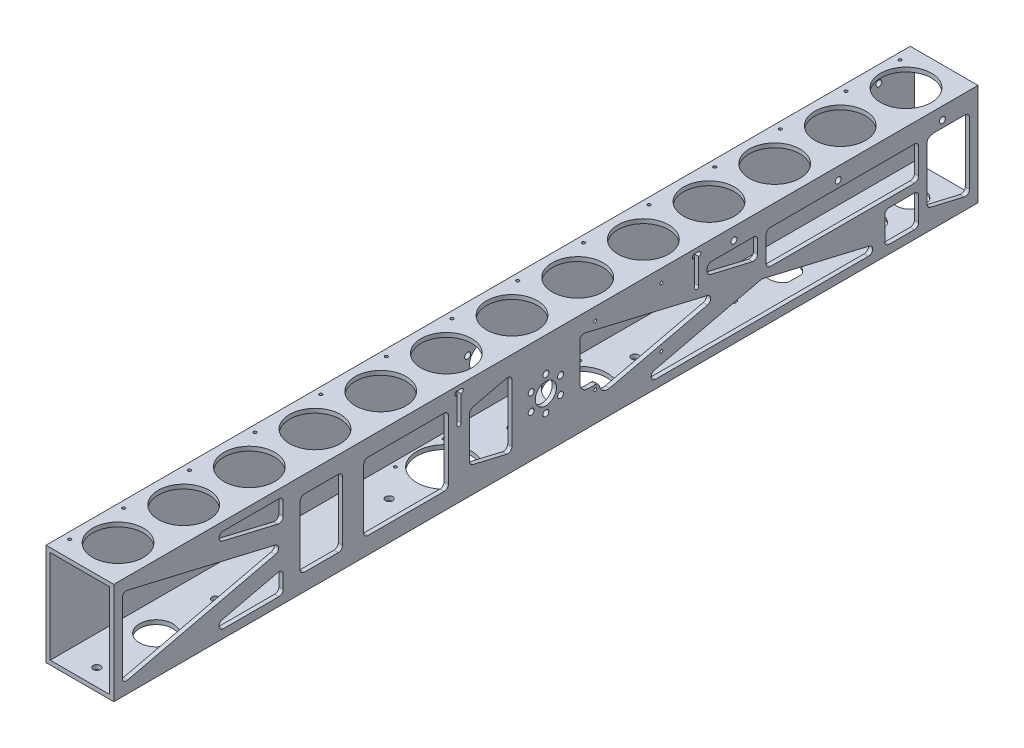
from build123d import *

# Parameters (mm, degrees)
SKETCH1_W                   = 50.8
SKETCH1_H                   = 76.2
SKETCH1_W_2                 = 44.45
SKETCH1_H_2                 = 69.85
BOSS_EXTRUDE1_DEPTH         = 647.7
CUT_EXTRUDE1_DEPTH          = 655.142469192
SKETCH4_R                   = 7.9375
CUT_EXTRUDE3_DEPTH          = 655.142469192
CUT_EXTRUDE4_REACH          = 656.142
SKETCH5_R                   = 9.525
F_8_CLEARANCE_HOLE1_D       = 4.4958
CIRPATTERN1_COUNT           = 6
SKETCH10_W                  = 57.15
SKETCH10_H                  = 76.2
BOSS_EXTRUDE2_DEPTH         = 3.175
CUT_EXTRUDE6_REACH          = 656.142
SKETCH17_W                  = 31.75
SKETCH17_H                  = 50.8
CUT_EXTRUDE10_REACH         = 656.142
SKETCH21_R                  = 20.447
F_4_40_TAPPED_HOLE1_D       = 2.2606
F_4_40_TAPPED_HOLE1_DEPTH   = 3.175
CUT_EXTRUDE11_REACH         = 656.142
LPATTERN1_COUNT             = 4
LPATTERN1_PITCH             = 31.75
SKETCH25_OUTSIDE_W          = 183.628
SKETCH25_OUTSIDE_H          = 780.528
SKETCH25_OUTSIDE_W_2        = 50.8
SKETCH25_OUTSIDE_H_2        = 647.7
CUT_EXTRUDE12_DEPTH         = 1.5875
F_1_4_28_TAPPED_HOLE2_D     = 5.4102
F_1_4_28_TAPPED_HOLE2_DEPTH = 3.175
CUT_EXTRUDE13_REACH         = 656.142
SKETCH28_R                  = 19.05
CUT_EXTRUDE14_REACH         = 656.142
SKETCH29_R                  = 19.05
BOSS_EXTRUDE3_DEPTH         = 3.175
BOSS_EXTRUDE4_DEPTH         = 3.175
BOSS_EXTRUDE5_DEPTH         = 3.175
BOSS_EXTRUDE6_START         = -3.175
BOSS_EXTRUDE6_DEPTH         = 3.175
CUT_EXTRUDE15_REACH         = 656.142
FILLET1_R                   = 3.175
BOSS_EXTRUDE7_DEPTH         = 3.175
FILLET2_R                   = 6.35
F_4_40_TAPPED_HOLE2_D       = 2.2606
F_4_40_TAPPED_HOLE2_DEPTH   = 3.175
SKETCH40_R                  = 19.05
SKETCH40_R_2                = 12.446
BOSS_EXTRUDE8_DEPTH         = 3.175
SKETCH41_W                  = 202.946
SKETCH41_H                  = 14.2875
BOSS_EXTRUDE9_DEPTH         = 3.175
FILLET3_R                   = 3.175
F_8_CLEARANCE_HOLE2_D       = 4.4958
F_8_CLEARANCE_HOLE2_DEPTH   = 3.175
SKETCH44_W                  = 202.946
SKETCH44_H                  = 14.2875
BOSS_EXTRUDE10_DEPTH        = 3.175
FILLET4_R                   = 3.175
F_8_CLEARANCE_HOLE3_D       = 4.4958
BOSS_EXTRUDE11_DEPTH        = 3.175
FILLET5_R                   = 3.175
CUT_EXTRUDE16_REACH         = 656.142
CUT_EXTRUDE17_REACH         = 656.142
SKETCH51_W                  = 68.2625
SKETCH51_H                  = 63.5
BOSS_EXTRUDE12_DEPTH        = 3.175
CUT_EXTRUDE18_REACH         = 656.142
BOSS_EXTRUDE13_DEPTH        = 1.016
F_4_40_TAPPED_HOLE3_D       = 2.2606
F_4_40_TAPPED_HOLE3_DEPTH   = 7.62
F_4_40_TAPPED_HOLE3_TIP     = 0.679152758
F_4_40_TAPPED_HOLE4_D       = 2.2606
F_4_40_TAPPED_HOLE4_DEPTH   = 7.62
F_4_40_TAPPED_HOLE4_TIP     = 0.679152758
BOSS_EXTRUDE14_DEPTH        = 3.175
BOSS_EXTRUDE15_START        = -1.016
BOSS_EXTRUDE15_DEPTH        = 1.016
FILLET6_R                   = 3.175
CUT_EXTRUDE19_START         = -2.159
CUT_EXTRUDE19_DEPTH         = 2.159


with BuildPart() as part:
    # Sketch1 → Boss-Extrude1 (new body)
    with BuildSketch(Plane.XY):
        with Locations((25.4, 38.1)):
            Rectangle(SKETCH1_W, SKETCH1_H)
        with Locations((25.4, 38.1)):
            Rectangle(SKETCH1_W_2, SKETCH1_H_2, mode=Mode.SUBTRACT)
    extrude(amount=BOSS_EXTRUDE1_DEPTH)

    # Sketch2 → Cut-Extrude1 (cut, through all)
    with BuildSketch(Plane(origin=(50.8, 0, 0), x_dir=(0, 0, -1), z_dir=(1, 0, 0))):
        with BuildLine():
            ThreePointArc((-566.359206485, 63.584400491), (-568.785835896, 67.041040679), (-565.632006601, 69.85))
            Line((-565.632006601, 69.85), (-405.917993399, 69.85))
            ThreePointArc((-405.917993399, 69.85), (-402.764164104, 67.041040679), (-405.190793515, 63.584400491))
            Line((-405.190793515, 63.584400491), (-485.047800115, 44.794516585))
            ThreePointArc((-485.047800115, 44.794516585), (-485.775, 44.710116094), (-486.502199885, 44.794516585))
            Line((-486.502199885, 44.794516585), (-566.359206485, 63.584400491))
        make_face()
        with BuildLine():
            Line((-637.447800115, 8.935693055), (-526.634543515, 35.009400491))
            ThreePointArc((-526.634543515, 35.009400491), (-524.186743399, 38.1), (-526.634543515, 41.190599509))
            Line((-526.634543515, 41.190599509), (-637.447800115, 67.264306945))
            ThreePointArc((-637.447800115, 67.264306945), (-640.146264235, 66.662631363), (-641.35, 64.173707435))
            Line((-641.35, 64.173707435), (-641.35, 12.026292565))
            ThreePointArc((-641.35, 12.026292565), (-640.146264235, 9.537368637), (-637.447800115, 8.935693055))
        make_face()
        with BuildLine():
            Line((-485.047800115, 31.405483415), (-405.190793515, 12.615599509))
            ThreePointArc((-405.190793515, 12.615599509), (-402.764164104, 9.158959321), (-405.917993399, 6.35))
            Line((-405.917993399, 6.35), (-565.632006601, 6.35))
            ThreePointArc((-565.632006601, 6.35), (-568.785835896, 9.158959321), (-566.359206485, 12.615599509))
            Line((-566.359206485, 12.615599509), (-486.502199885, 31.405483415))
            ThreePointArc((-486.502199885, 31.405483415), (-485.775, 31.489883906), (-485.047800115, 31.405483415))
        make_face()
        with BuildLine():
            ThreePointArc((-444.915456485, 35.009400491), (-447.363256601, 38.1), (-444.915456485, 41.190599509))
            Line((-444.915456485, 41.190599509), (-353.152199885, 62.781954004))
            ThreePointArc((-353.152199885, 62.781954004), (-350.453735765, 62.180278422), (-349.25, 59.691354494))
            Line((-349.25, 59.691354494), (-349.25, 16.508645506))
            ThreePointArc((-349.25, 16.508645506), (-350.453735765, 14.019721578), (-353.152199885, 13.418045996))
            Line((-353.152199885, 13.418045996), (-444.915456485, 35.009400491))
        make_face()
        with BuildLine():
            Line((-294.547800115, 62.781954004), (-202.784543515, 41.190599509))
            ThreePointArc((-202.784543515, 41.190599509), (-200.336743399, 38.1), (-202.784543515, 35.009400491))
            Line((-202.784543515, 35.009400491), (-294.547800115, 13.418045996))
            ThreePointArc((-294.547800115, 13.418045996), (-297.246264235, 14.019721578), (-298.45, 16.508645506))
            Line((-298.45, 16.508645506), (-298.45, 59.691354494))
            ThreePointArc((-298.45, 59.691354494), (-297.246264235, 62.180278422), (-294.547800115, 62.781954004))
        make_face()
        with BuildLine():
            ThreePointArc((-161.197800115, 44.794516585), (-161.925, 44.710116094), (-162.652199885, 44.794516585))
            Line((-162.652199885, 44.794516585), (-242.509206485, 63.584400491))
            ThreePointArc((-242.509206485, 63.584400491), (-244.935835896, 67.041040679), (-241.782006601, 69.85))
            Line((-241.782006601, 69.85), (-82.067993399, 69.85))
            ThreePointArc((-82.067993399, 69.85), (-78.914164104, 67.041040679), (-81.340793515, 63.584400491))
            Line((-81.340793515, 63.584400491), (-161.197800115, 44.794516585))
        make_face()
        with BuildLine():
            Line((-161.197800115, 31.405483415), (-81.340793515, 12.615599509))
            ThreePointArc((-81.340793515, 12.615599509), (-78.914164104, 9.158959321), (-82.067993399, 6.35))
            Line((-82.067993399, 6.35), (-241.782006601, 6.35))
            ThreePointArc((-241.782006601, 6.35), (-244.935835896, 9.158959321), (-242.509206485, 12.615599509))
            Line((-242.509206485, 12.615599509), (-162.652199885, 31.405483415))
            ThreePointArc((-162.652199885, 31.405483415), (-161.925, 31.489883906), (-161.197800115, 31.405483415))
        make_face()
        with BuildLine():
            Line((-121.065456485, 41.190599509), (-10.252199885, 67.264306945))
            ThreePointArc((-10.252199885, 67.264306945), (-7.553735765, 66.662631363), (-6.35, 64.173707435))
            Line((-6.35, 64.173707435), (-6.35, 12.026292565))
            ThreePointArc((-6.35, 12.026292565), (-7.553735765, 9.537368637), (-10.252199885, 8.935693055))
            Line((-10.252199885, 8.935693055), (-121.065456485, 35.009400491))
            ThreePointArc((-121.065456485, 35.009400491), (-123.513256601, 38.1), (-121.065456485, 41.190599509))
        make_face()
    extrude(amount=-CUT_EXTRUDE1_DEPTH, mode=Mode.SUBTRACT)

    # Sketch4 → Cut-Extrude3 (cut, through all)
    with BuildSketch(Plane(origin=(50.8, 0, 0), x_dir=(0, 0, -1), z_dir=(1, 0, 0))):
        with Locations((-323.85, 38.1)):
            Circle(SKETCH4_R)
    extrude(amount=-CUT_EXTRUDE3_DEPTH, mode=Mode.SUBTRACT)

    # Sketch5 → Cut-Extrude4 (cut, up to next)
    with BuildSketch(Plane.ZY, mode=Mode.PRIVATE) as cut_extrude4_sk1:
        with Locations((323.85, 38.1)):
            Circle(SKETCH5_R)
    cut_extrude4_tool1 = extrude(cut_extrude4_sk1.sketch, amount=-CUT_EXTRUDE4_REACH, mode=Mode.PRIVATE) & part.part
    add(cut_extrude4_tool1.solids().sort_by_distance((0, 38.1, 323.85))[0], mode=Mode.SUBTRACT)

    # #8 Clearance Hole1 (through all)
    with Locations(Plane.ZY):
        with Locations((323.85, 50.8)):
            f_8_clearance_hole1 = Hole(F_8_CLEARANCE_HOLE1_D / 2)

    # CirPattern1: #8 Clearance Hole1 ×6 about axis
    cirpattern1_axis = Axis((0, 38.1, 323.85), (1, 0, 0))
    for i in range(1, CIRPATTERN1_COUNT):
        add(f_8_clearance_hole1.rotate(cirpattern1_axis, i * 360 / CIRPATTERN1_COUNT), mode=Mode.SUBTRACT)

    # Sketch10 → Boss-Extrude2 (add)
    with BuildSketch(Plane(origin=(50.8, 0, 0), x_dir=(0, 0, -1), z_dir=(1, 0, 0))):
        with Locations((-492.125, 38.1)):
            Rectangle(SKETCH10_W, SKETCH10_H)
    extrude(amount=-BOSS_EXTRUDE2_DEPTH)

    # Sketch17 → Cut-Extrude6 (cut, up to next)
    with BuildSketch(Plane(origin=(50.8, 0, 0), x_dir=(0, 0, -1), z_dir=(1, 0, 0)), mode=Mode.PRIVATE) as cut_extrude6_sk1:
        with Locations((-492.125, 38.1)):
            Rectangle(SKETCH17_W, SKETCH17_H)
    cut_extrude6_tool1 = extrude(cut_extrude6_sk1.sketch, amount=-CUT_EXTRUDE6_REACH, mode=Mode.PRIVATE) & part.part
    add(cut_extrude6_tool1.solids().sort_by_distance((50.8, 38.1, 492.125))[0], mode=Mode.SUBTRACT)

    # Sketch21 → Cut-Extrude10 (cut, up to next)
    with BuildSketch(Plane.XZ, mode=Mode.PRIVATE) as cut_extrude10_sk1:
        with Locations(Location((25.4, 374.65, 0), (0, 0, 270))):
            Circle(SKETCH21_R)
    cut_extrude10_tool1 = extrude(cut_extrude10_sk1.sketch, amount=-CUT_EXTRUDE10_REACH, mode=Mode.PRIVATE) & part.part
    # Sketch21 → Cut-Extrude10 (cut, up to next)
    with BuildSketch(Plane.XZ, mode=Mode.PRIVATE) as cut_extrude10_sk2:
        with Locations(Location((25.4, 273.05, 0), (0, 0, 270))):
            Circle(SKETCH21_R)
    cut_extrude10_tool2 = extrude(cut_extrude10_sk2.sketch, amount=-CUT_EXTRUDE10_REACH, mode=Mode.PRIVATE) & part.part
    add(cut_extrude10_tool1.solids().sort_by_distance((25.4, 0, 374.65))[0], mode=Mode.SUBTRACT)
    add(cut_extrude10_tool2.solids().sort_by_distance((25.4, 0, 273.05))[0], mode=Mode.SUBTRACT)

    # #4-40 Tapped Hole1
    with Locations(Plane.XZ):
        with Locations((7.1374, 392.9126), (43.6626, 392.9126), (7.1374, 356.3874), (43.6626, 356.3874), (7.1374, 291.3126), (43.6626, 291.3126), (7.1374, 254.7874), (43.6626, 254.7874)):
            Hole(F_4_40_TAPPED_HOLE1_D / 2, depth=F_4_40_TAPPED_HOLE1_DEPTH)

    # Sketch24 → Cut-Extrude11 (cut, up to next)
    with BuildSketch(Plane.XZ, mode=Mode.PRIVATE) as cut_extrude11_sk1:
        with BuildLine():
            Line((34.4043, 115.443309765), (34.4043, 125.856690235))
            ThreePointArc((34.4043, 125.856690235), (14.9987, 120.65), (34.4043, 115.443309765))
        make_face()
    cut_extrude11_tool1 = extrude(cut_extrude11_sk1.sketch, amount=-CUT_EXTRUDE11_REACH, mode=Mode.PRIVATE) & part.part
    cut_extrude11 = cut_extrude11_tool1.solids().sort_by_distance((25.114883, 0, 120.65))[0]
    add(cut_extrude11, mode=Mode.SUBTRACT)

    # LPattern1: Cut-Extrude11 ×4
    with Locations(*[(0, 0, -i * LPATTERN1_PITCH) for i in range(1, LPATTERN1_COUNT)]):
        add(cut_extrude11, mode=Mode.SUBTRACT)

    # Sketch25 outside → Cut-Extrude12 (cut)
    # profile 1 of 2: a face of its own
    with BuildSketch(Plane.XZ):
        with Locations((25.4, 323.85)):
            Rectangle(SKETCH25_OUTSIDE_W, SKETCH25_OUTSIDE_H)
        with Locations((25.4, 323.85)):
            Rectangle(SKETCH25_OUTSIDE_W_2, SKETCH25_OUTSIDE_H_2, mode=Mode.SUBTRACT)
    # profile 2 of 2: a face of its own
    with BuildSketch(Plane.XZ):
        with BuildLine():
            Line((15.24, 136.525), (35.56, 136.525))
            ThreePointArc((35.56, 136.525), (40.050128061, 134.665128061), (41.91, 130.175))
            Line((41.91, 130.175), (41.91, 15.875))
            ThreePointArc((41.91, 15.875), (40.050128061, 11.384871939), (35.56, 9.525))
            Line((35.56, 9.525), (15.24, 9.525))
            ThreePointArc((15.24, 9.525), (10.749871939, 11.384871939), (8.89, 15.875))
            Line((8.89, 15.875), (8.89, 130.175))
            ThreePointArc((8.89, 130.175), (10.749871939, 134.665128061), (15.24, 136.525))
        make_face()
    extrude(amount=-CUT_EXTRUDE12_DEPTH, mode=Mode.SUBTRACT)

    # 1/4-28 Tapped Hole2
    with Locations(Plane(origin=(14.411498221, 0, -20.300426017), x_dir=(1, 0, 0), z_dir=(0, -1, 0))):
        with Locations((10.988501779, 179.050426017), (10.988501779, 252.075426017), (10.988501779, 344.150426017), (10.988501779, 436.225426017), (10.988501779, 566.400426017), (10.988501779, 655.300426017)):
            Hole(F_1_4_28_TAPPED_HOLE2_D / 2, depth=F_1_4_28_TAPPED_HOLE2_DEPTH)

    # Sketch28 → Cut-Extrude13 (cut, up to next)
    with BuildSketch(Plane.XZ, mode=Mode.PRIVATE) as cut_extrude13_sk1:
        with Locations(Location((25.4, 195.2625, 0), (0, 0, 270))):
            Circle(SKETCH28_R)
    cut_extrude13_tool1 = extrude(cut_extrude13_sk1.sketch, amount=-CUT_EXTRUDE13_REACH, mode=Mode.PRIVATE) & part.part
    # Sketch28 → Cut-Extrude13 (cut, up to next)
    with BuildSketch(Plane.XZ, mode=Mode.PRIVATE) as cut_extrude13_sk2:
        with Locations(Location((25.4, 455.6125, 0), (0, 0, 270))):
            Circle(SKETCH28_R)
    cut_extrude13_tool2 = extrude(cut_extrude13_sk2.sketch, amount=-CUT_EXTRUDE13_REACH, mode=Mode.PRIVATE) & part.part
    # Sketch28 → Cut-Extrude13 (cut, up to next)
    with BuildSketch(Plane.XZ, mode=Mode.PRIVATE) as cut_extrude13_sk3:
        with Locations(Location((25.4, 506.4125, 0), (0, 0, 270))):
            Circle(SKETCH28_R)
    cut_extrude13_tool3 = extrude(cut_extrude13_sk3.sketch, amount=-CUT_EXTRUDE13_REACH, mode=Mode.PRIVATE) & part.part
    # Sketch28 → Cut-Extrude13 (cut, up to next)
    with BuildSketch(Plane.XZ, mode=Mode.PRIVATE) as cut_extrude13_sk4:
        with Locations(Location((25.4, 590.55, 0), (0, 0, 270))):
            Circle(SKETCH28_R)
    cut_extrude13_tool4 = extrude(cut_extrude13_sk4.sketch, amount=-CUT_EXTRUDE13_REACH, mode=Mode.PRIVATE) & part.part
    add(cut_extrude13_tool1.solids().sort_by_distance((25.4, 0, 195.2625))[0], mode=Mode.SUBTRACT)
    add(cut_extrude13_tool2.solids().sort_by_distance((25.4, 0, 455.6125))[0], mode=Mode.SUBTRACT)
    add(cut_extrude13_tool3.solids().sort_by_distance((25.4, 0, 506.4125))[0], mode=Mode.SUBTRACT)
    add(cut_extrude13_tool4.solids().sort_by_distance((25.4, 0, 590.55))[0], mode=Mode.SUBTRACT)

    # Sketch29 → Cut-Extrude14 (cut, up to next)
    with BuildSketch(Plane(origin=(0, 76.2, 0), x_dir=(1, 0, 0), z_dir=(0, 1, 0)), mode=Mode.PRIVATE) as cut_extrude14_sk1:
        with Locations(Location((25.4, -28.575, 0), (0, 0, 270))):
            Circle(SKETCH29_R)
    cut_extrude14_tool1 = extrude(cut_extrude14_sk1.sketch, amount=-CUT_EXTRUDE14_REACH, mode=Mode.PRIVATE) & part.part
    # Sketch29 → Cut-Extrude14 (cut, up to next)
    with BuildSketch(Plane(origin=(0, 76.2, 0), x_dir=(1, 0, 0), z_dir=(0, 1, 0)), mode=Mode.PRIVATE) as cut_extrude14_sk2:
        with Locations(Location((25.4, -77.7875, 0), (0, 0, 270))):
            Circle(SKETCH29_R)
    cut_extrude14_tool2 = extrude(cut_extrude14_sk2.sketch, amount=-CUT_EXTRUDE14_REACH, mode=Mode.PRIVATE) & part.part
    # Sketch29 → Cut-Extrude14 (cut, up to next)
    with BuildSketch(Plane(origin=(0, 76.2, 0), x_dir=(1, 0, 0), z_dir=(0, 1, 0)), mode=Mode.PRIVATE) as cut_extrude14_sk3:
        with Locations(Location((25.4, -127, 0), (0, 0, 270))):
            Circle(SKETCH29_R)
    cut_extrude14_tool3 = extrude(cut_extrude14_sk3.sketch, amount=-CUT_EXTRUDE14_REACH, mode=Mode.PRIVATE) & part.part
    # Sketch29 → Cut-Extrude14 (cut, up to next)
    with BuildSketch(Plane(origin=(0, 76.2, 0), x_dir=(1, 0, 0), z_dir=(0, 1, 0)), mode=Mode.PRIVATE) as cut_extrude14_sk4:
        with Locations(Location((25.4, -176.2125, 0), (0, 0, 270))):
            Circle(SKETCH29_R)
    cut_extrude14_tool4 = extrude(cut_extrude14_sk4.sketch, amount=-CUT_EXTRUDE14_REACH, mode=Mode.PRIVATE) & part.part
    # Sketch29 → Cut-Extrude14 (cut, up to next)
    with BuildSketch(Plane(origin=(0, 76.2, 0), x_dir=(1, 0, 0), z_dir=(0, 1, 0)), mode=Mode.PRIVATE) as cut_extrude14_sk5:
        with Locations(Location((25.4, -225.425, 0), (0, 0, 270))):
            Circle(SKETCH29_R)
    cut_extrude14_tool5 = extrude(cut_extrude14_sk5.sketch, amount=-CUT_EXTRUDE14_REACH, mode=Mode.PRIVATE) & part.part
    # Sketch29 → Cut-Extrude14 (cut, up to next)
    with BuildSketch(Plane(origin=(0, 76.2, 0), x_dir=(1, 0, 0), z_dir=(0, 1, 0)), mode=Mode.PRIVATE) as cut_extrude14_sk6:
        with Locations(Location((25.4, -274.6375, 0), (0, 0, 270))):
            Circle(SKETCH29_R)
    cut_extrude14_tool6 = extrude(cut_extrude14_sk6.sketch, amount=-CUT_EXTRUDE14_REACH, mode=Mode.PRIVATE) & part.part
    # Sketch29 → Cut-Extrude14 (cut, up to next)
    with BuildSketch(Plane(origin=(0, 76.2, 0), x_dir=(1, 0, 0), z_dir=(0, 1, 0)), mode=Mode.PRIVATE) as cut_extrude14_sk7:
        with Locations(Location((25.4, -323.85, 0), (0, 0, 270))):
            Circle(SKETCH29_R)
    cut_extrude14_tool7 = extrude(cut_extrude14_sk7.sketch, amount=-CUT_EXTRUDE14_REACH, mode=Mode.PRIVATE) & part.part
    # Sketch29 → Cut-Extrude14 (cut, up to next)
    with BuildSketch(Plane(origin=(0, 76.2, 0), x_dir=(1, 0, 0), z_dir=(0, 1, 0)), mode=Mode.PRIVATE) as cut_extrude14_sk8:
        with Locations(Location((25.4, -373.0625, 0), (0, 0, 270))):
            Circle(SKETCH29_R)
    cut_extrude14_tool8 = extrude(cut_extrude14_sk8.sketch, amount=-CUT_EXTRUDE14_REACH, mode=Mode.PRIVATE) & part.part
    # Sketch29 → Cut-Extrude14 (cut, up to next)
    with BuildSketch(Plane(origin=(0, 76.2, 0), x_dir=(1, 0, 0), z_dir=(0, 1, 0)), mode=Mode.PRIVATE) as cut_extrude14_sk9:
        with Locations(Location((25.4, -422.275, 0), (0, 0, 270))):
            Circle(SKETCH29_R)
    cut_extrude14_tool9 = extrude(cut_extrude14_sk9.sketch, amount=-CUT_EXTRUDE14_REACH, mode=Mode.PRIVATE) & part.part
    # Sketch29 → Cut-Extrude14 (cut, up to next)
    with BuildSketch(Plane(origin=(0, 76.2, 0), x_dir=(1, 0, 0), z_dir=(0, 1, 0)), mode=Mode.PRIVATE) as cut_extrude14_sk10:
        with Locations(Location((25.4, -471.4875, 0), (0, 0, 270))):
            Circle(SKETCH29_R)
    cut_extrude14_tool10 = extrude(cut_extrude14_sk10.sketch, amount=-CUT_EXTRUDE14_REACH, mode=Mode.PRIVATE) & part.part
    # Sketch29 → Cut-Extrude14 (cut, up to next)
    with BuildSketch(Plane(origin=(0, 76.2, 0), x_dir=(1, 0, 0), z_dir=(0, 1, 0)), mode=Mode.PRIVATE) as cut_extrude14_sk11:
        with Locations(Location((25.4, -520.7, 0), (0, 0, 270))):
            Circle(SKETCH29_R)
    cut_extrude14_tool11 = extrude(cut_extrude14_sk11.sketch, amount=-CUT_EXTRUDE14_REACH, mode=Mode.PRIVATE) & part.part
    # Sketch29 → Cut-Extrude14 (cut, up to next)
    with BuildSketch(Plane(origin=(0, 76.2, 0), x_dir=(1, 0, 0), z_dir=(0, 1, 0)), mode=Mode.PRIVATE) as cut_extrude14_sk12:
        with Locations(Location((25.4, -569.9125, 0), (0, 0, 270))):
            Circle(SKETCH29_R)
    cut_extrude14_tool12 = extrude(cut_extrude14_sk12.sketch, amount=-CUT_EXTRUDE14_REACH, mode=Mode.PRIVATE) & part.part
    # Sketch29 → Cut-Extrude14 (cut, up to next)
    with BuildSketch(Plane(origin=(0, 76.2, 0), x_dir=(1, 0, 0), z_dir=(0, 1, 0)), mode=Mode.PRIVATE) as cut_extrude14_sk13:
        with Locations(Location((25.4, -619.125, 0), (0, 0, 270))):
            Circle(SKETCH29_R)
    cut_extrude14_tool13 = extrude(cut_extrude14_sk13.sketch, amount=-CUT_EXTRUDE14_REACH, mode=Mode.PRIVATE) & part.part
    add(cut_extrude14_tool1.solids().sort_by_distance((25.4, 76.2, 28.575))[0], mode=Mode.SUBTRACT)
    add(cut_extrude14_tool2.solids().sort_by_distance((25.4, 76.2, 77.7875))[0], mode=Mode.SUBTRACT)
    add(cut_extrude14_tool3.solids().sort_by_distance((25.4, 76.2, 127))[0], mode=Mode.SUBTRACT)
    add(cut_extrude14_tool4.solids().sort_by_distance((25.4, 76.2, 176.2125))[0], mode=Mode.SUBTRACT)
    add(cut_extrude14_tool5.solids().sort_by_distance((25.4, 76.2, 225.425))[0], mode=Mode.SUBTRACT)
    add(cut_extrude14_tool6.solids().sort_by_distance((25.4, 76.2, 274.6375))[0], mode=Mode.SUBTRACT)
    add(cut_extrude14_tool7.solids().sort_by_distance((25.4, 76.2, 323.85))[0], mode=Mode.SUBTRACT)
    add(cut_extrude14_tool8.solids().sort_by_distance((25.4, 76.2, 373.0625))[0], mode=Mode.SUBTRACT)
    add(cut_extrude14_tool9.solids().sort_by_distance((25.4, 76.2, 422.275))[0], mode=Mode.SUBTRACT)
    add(cut_extrude14_tool10.solids().sort_by_distance((25.4, 76.2, 471.4875))[0], mode=Mode.SUBTRACT)
    add(cut_extrude14_tool11.solids().sort_by_distance((25.4, 76.2, 520.7))[0], mode=Mode.SUBTRACT)
    add(cut_extrude14_tool12.solids().sort_by_distance((25.4, 76.2, 569.9125))[0], mode=Mode.SUBTRACT)
    add(cut_extrude14_tool13.solids().sort_by_distance((25.4, 76.2, 619.125))[0], mode=Mode.SUBTRACT)

    # Sketch30 → Boss-Extrude3 (add)
    with BuildSketch(Plane(origin=(50.8, 0, 0), x_dir=(0, 0, -1), z_dir=(1, 0, 0))):
        Polygon((-381, 56.229530447), (-395.2875, 52.867765741), (-395.2875, 23.332234259), (-381, 19.970469553), align=None)
    extrude(amount=-BOSS_EXTRUDE3_DEPTH)

    # Sketch32 → Boss-Extrude4 (add)
    with BuildSketch(Plane.ZY):
        Polygon((395.2875, 52.867765741), (395.2875, 23.332234259), (381, 19.970469553), (381, 56.229530447), align=None)
    extrude(amount=-BOSS_EXTRUDE4_DEPTH)

    # Sketch33 → Boss-Extrude5 (add)
    with BuildSketch(Plane(origin=(50.8, 0, 0), x_dir=(0, 0, -1), z_dir=(1, 0, 0))):
        with BuildLine():
            Line((-202.946, 69.85), (-202.946, 54.275410729))
            Line((-202.946, 54.275410729), (-242.509206485, 63.584400491))
            ThreePointArc((-242.509206485, 63.584400491), (-244.935835896, 67.041040679), (-241.782006601, 69.85))
            Line((-241.782006601, 69.85), (-202.946, 69.85))
        make_face()
    extrude(amount=-BOSS_EXTRUDE5_DEPTH)

    # Sketch34 → Boss-Extrude6 (add)
    with BuildSketch(Plane.ZY.offset(BOSS_EXTRUDE6_START)):
        with BuildLine():
            Line((241.782006601, 69.85), (202.946, 69.85))
            Line((202.946, 69.85), (202.946, 54.275410729))
            Line((202.946, 54.275410729), (242.509206485, 63.584400491))
            ThreePointArc((242.509206485, 63.584400491), (244.935835896, 67.041040679), (241.782006601, 69.85))
        make_face()
    extrude(amount=BOSS_EXTRUDE6_DEPTH)

    # Sketch31 → Cut-Extrude15 (cut, up to next)
    with BuildSketch(Plane(origin=(50.8, 0, 0), x_dir=(0, 0, -1), z_dir=(1, 0, 0)), mode=Mode.PRIVATE) as cut_extrude15_sk1:
        with BuildLine():
            Line((-390.525, 69.850002153), (-390.525, 50.8))
            ThreePointArc((-390.525, 50.8), (-388.9375, 49.2125), (-387.35, 50.8))
            Line((-387.35, 50.8), (-387.35, 69.85))
            ThreePointArc((-387.35, 69.85), (-385.762499162, 71.4375), (-387.35, 73.025))
            Line((-387.35, 73.025), (-390.525, 73.024997847))
            ThreePointArc((-390.525, 73.024997847), (-392.112497847, 71.4375), (-390.525, 69.850002153))
        make_face()
    cut_extrude15_tool1 = extrude(cut_extrude15_sk1.sketch, amount=-CUT_EXTRUDE15_REACH, mode=Mode.PRIVATE) & part.part
    # Sketch31 → Cut-Extrude15 (cut, up to next)
    with BuildSketch(Plane(origin=(50.8, 0, 0), x_dir=(0, 0, -1), z_dir=(1, 0, 0)), mode=Mode.PRIVATE) as cut_extrude15_sk2:
        with BuildLine():
            Line((-212.471, 69.850122911), (-212.471, 50.800120757))
            ThreePointArc((-212.471, 50.800120757), (-210.8835, 49.212620757), (-209.296, 50.800120757))
            Line((-209.296, 50.800120757), (-209.296, 69.850120757))
            ThreePointArc((-209.296, 69.850120757), (-207.708499162, 71.437620757), (-209.296, 73.025120757))
            Line((-209.296, 73.025120757), (-212.471, 73.025118604))
            ThreePointArc((-212.471, 73.025118604), (-214.058497847, 71.437620757), (-212.471, 69.850122911))
        make_face()
    cut_extrude15_tool2 = extrude(cut_extrude15_sk2.sketch, amount=-CUT_EXTRUDE15_REACH, mode=Mode.PRIVATE) & part.part
    add(cut_extrude15_tool1.solids().sort_by_distance((50.8, 62.261292, 388.9375))[0], mode=Mode.SUBTRACT)
    add(cut_extrude15_tool2.solids().sort_by_distance((50.8, 62.261413, 210.8835))[0], mode=Mode.SUBTRACT)

    # Fillet1
    fillet1_edges = [part.edges().sort_by_distance(p)[0] for p in [
        (49.2125, 23.358942212, 520.7),
        (49.2125, 6.35, 463.55),
        (49.2125, 69.85, 463.55),
        (49.2125, 49.852822494, 463.55),
        (49.2125, 26.347177506, 463.55),
        (49.2125, 69.85, 520.7),
        (49.2125, 52.841057788, 520.7),
        (49.2125, 6.35, 520.7),
        (49.2125, 63.5, 508),
        (49.2125, 12.7, 508),
        (49.2125, 12.7, 476.25),
        (49.2125, 63.5, 476.25),
        (49.2125, 52.867765741, 395.2875),
        (49.2125, 23.332234259, 395.2875),
        (49.2125, 19.970469553, 381),
        (49.2125, 56.229530447, 381),
        (1.5875, 19.970469553, 381),
        (1.5875, 23.332234259, 395.2875),
        (1.5875, 52.867765741, 395.2875),
        (1.5875, 56.229530447, 381),
        (49.2125, 54.275410729, 202.946),
        (49.2125, 69.85, 202.946),
        (1.5875, 69.85, 202.946),
        (1.5875, 54.275410729, 202.946),
    ]]
    fillet(fillet1_edges, radius=FILLET1_R)

    # Sketch36 → Boss-Extrude7 (add)
    with BuildSketch(Plane(origin=(50.8, 0, 0), x_dir=(0, 0, -1), z_dir=(1, 0, 0))):
        with BuildLine():
            Line((-298.45, 25.4), (-298.45, 16.508645506))
            ThreePointArc((-298.45, 16.508645506), (-297.246264235, 14.019721578), (-294.547800115, 13.418045996))
            Line((-294.547800115, 13.418045996), (-283.708940003, 15.968366023))
            Line((-283.708940003, 15.968366023), (-283.708940003, 22.225))
            ThreePointArc((-283.708940003, 22.225), (-284.638875973, 24.47006403), (-286.883940003, 25.4))
            Line((-286.883940003, 25.4), (-298.45, 25.4))
        make_face()
    extrude(amount=-BOSS_EXTRUDE7_DEPTH)

    # Fillet2
    fillet2_edges = [part.edges().sort_by_distance(p)[0] for p in [
        (49.2125, 15.968366023, 283.708940003),
        (49.2125, 25.4, 298.45),
    ]]
    fillet(fillet2_edges, radius=FILLET2_R)

    # #4-40 Tapped Hole2
    with Locations(Plane(origin=(50.8, 0, 0), x_dir=(0, 0, -1), z_dir=(1, 0, 0))):
        with Locations((-286.883940003, 66.675), (-237.353940003, 66.675), (-286.883940003, 22.225), (-237.353940003, 22.225)):
            Hole(F_4_40_TAPPED_HOLE2_D / 2, depth=F_4_40_TAPPED_HOLE2_DEPTH)

    # Sketch40 → Boss-Extrude8 (add)
    with BuildSketch(Plane.XZ):
        with Locations((25.4, 590.55)):
            Circle(SKETCH40_R)
        with Locations(Location((25.4, 590.55, 0), (0, 0, 270))):
            Circle(SKETCH40_R_2, mode=Mode.SUBTRACT)
    extrude(amount=-BOSS_EXTRUDE8_DEPTH)

    # Sketch41 → Boss-Extrude9 (add)
    with BuildSketch(Plane(origin=(50.8, 0, 0), x_dir=(0, 0, -1), z_dir=(1, 0, 0))):
        with Locations((-101.473, 69.05625)):
            Rectangle(SKETCH41_W, SKETCH41_H)
    extrude(amount=-BOSS_EXTRUDE9_DEPTH)

    # Fillet3
    fillet3_edges = [part.edges().sort_by_distance(p)[0] for p in [
        (49.2125, 61.9125, 88.4463706),
        (49.2125, 61.9125, 32.9973794),
        (49.2125, 61.9125, 202.946),
        (49.2125, 61.9125, 6.35),
    ]]
    fillet(fillet3_edges, radius=FILLET3_R)

    # #8 Clearance Hole2
    with Locations(Plane(origin=(50.8, 0, 0), x_dir=(0, 0, -1), z_dir=(1, 0, 0))):
        with Locations((-26.67, 66.9925), (-104.775, 66.9925), (-182.88, 66.9925)):
            Hole(F_8_CLEARANCE_HOLE2_D / 2, depth=F_8_CLEARANCE_HOLE2_DEPTH)

    # Sketch44 → Boss-Extrude10 (add)
    with BuildSketch(Plane.ZY):
        with Locations((101.473, 69.05625)):
            Rectangle(SKETCH44_W, SKETCH44_H)
    extrude(amount=-BOSS_EXTRUDE10_DEPTH)

    # Fillet4
    fillet4_edges = [part.edges().sort_by_distance(p)[0] for p in [
        (1.5875, 61.9125, 202.946),
        (1.5875, 61.9125, 32.9973794),
        (1.5875, 61.9125, 88.4463706),
        (1.5875, 61.9125, 6.35),
    ]]
    fillet(fillet4_edges, radius=FILLET4_R)

    # #8 Clearance Hole3 (through all)
    with Locations(Plane(origin=(3.175, 0, 0), x_dir=(0, 0, -1), z_dir=(1, 0, 0))):
        with Locations((-26.67, 66.9925), (-104.775, 66.9925), (-182.88, 66.9925)):
            Hole(F_8_CLEARANCE_HOLE3_D / 2)

    # Sketch48 → Boss-Extrude11 (add)
    with BuildSketch(Plane(origin=(50.8, 0, 0), x_dir=(0, 0, -1), z_dir=(1, 0, 0))):
        Polygon((-165.1, 61.9125), (-38.1, 61.9125), (-38.1, 15.488116612), (-121.065456485, 35.009400491), (-165.1, 35.009400491), align=None)
    extrude(amount=-BOSS_EXTRUDE11_DEPTH)

    # Fillet5
    fillet5_edges = [part.edges().sort_by_distance(p)[0] for p in [
        (49.2125, 61.9125, 165.1),
        (49.2125, 15.488116612, 38.1),
        (49.2125, 60.711883388, 38.1),
        (49.2125, 45.370469553, 165.1),
    ]]
    fillet(fillet5_edges, radius=FILLET5_R)

    # Sketch49 → Cut-Extrude16 (cut, up to next)
    with BuildSketch(Plane(origin=(50.8, 0, 0), x_dir=(0, 0, -1), z_dir=(1, 0, 0)), mode=Mode.PRIVATE) as cut_extrude16_sk1:
        with BuildLine():
            Line((-155.575, 61.9125), (-47.625, 61.9125))
            ThreePointArc((-47.625, 61.9125), (-45.37993597, 60.98256403), (-44.45, 58.7375))
            Line((-44.45, 58.7375), (-44.45, 39.6875))
            ThreePointArc((-44.45, 39.6875), (-45.37993597, 37.44243597), (-47.625, 36.5125))
            Line((-47.625, 36.5125), (-155.575, 36.5125))
            ThreePointArc((-155.575, 36.5125), (-157.82006403, 37.44243597), (-158.75, 39.6875))
            Line((-158.75, 39.6875), (-158.75, 58.7375))
            ThreePointArc((-158.75, 58.7375), (-157.82006403, 60.98256403), (-155.575, 61.9125))
        make_face()
    cut_extrude16_tool1 = extrude(cut_extrude16_sk1.sketch, amount=-CUT_EXTRUDE16_REACH, mode=Mode.PRIVATE) & part.part
    add(cut_extrude16_tool1.solids().sort_by_distance((50.8, 49.2125, 101.6))[0], mode=Mode.SUBTRACT)

    # Sketch50 → Cut-Extrude17 (cut, up to next)
    with BuildSketch(Plane(origin=(50.8, 0, 0), x_dir=(0, 0, -1), z_dir=(1, 0, 0)), mode=Mode.PRIVATE) as cut_extrude17_sk1:
        with BuildLine():
            Line((-47.625, 30.1625), (-66.675, 30.1625))
            ThreePointArc((-66.675, 30.1625), (-68.92006403, 29.23256403), (-69.85, 26.9875))
            Line((-69.85, 26.9875), (-69.85, 9.525))
            ThreePointArc((-69.85, 9.525), (-68.92006403, 7.27993597), (-66.675, 6.35))
            Line((-66.675, 6.35), (-47.625, 6.35))
            ThreePointArc((-47.625, 6.35), (-45.37993597, 7.27993597), (-44.45, 9.525))
            Line((-44.45, 9.525), (-44.45, 26.9875))
            ThreePointArc((-44.45, 26.9875), (-45.37993597, 29.23256403), (-47.625, 30.1625))
        make_face()
    cut_extrude17_tool1 = extrude(cut_extrude17_sk1.sketch, amount=-CUT_EXTRUDE17_REACH, mode=Mode.PRIVATE) & part.part
    add(cut_extrude17_tool1.solids().sort_by_distance((50.8, 18.25625, 57.15))[0], mode=Mode.SUBTRACT)

    # Sketch51 → Boss-Extrude12 (add)
    with BuildSketch(Plane(origin=(50.8, 0, 0), x_dir=(0, 0, -1), z_dir=(1, 0, 0))):
        with Locations((-429.41875, 38.1)):
            Rectangle(SKETCH51_W, SKETCH51_H)
    extrude(amount=-BOSS_EXTRUDE12_DEPTH)

    # Sketch52 → Cut-Extrude18 (cut, up to next)
    with BuildSketch(Plane(origin=(50.8, 0, 0), x_dir=(0, 0, -1), z_dir=(1, 0, 0)), mode=Mode.PRIVATE) as cut_extrude18_sk1:
        with BuildLine():
            Line((-457.2, 63.5), (-400.05, 63.5))
            ThreePointArc((-400.05, 63.5), (-397.80493597, 62.57006403), (-396.875, 60.325))
            Line((-396.875, 60.325), (-396.875, 15.875))
            ThreePointArc((-396.875, 15.875), (-397.80493597, 13.62993597), (-400.05, 12.7))
            Line((-400.05, 12.7), (-457.2, 12.7))
            ThreePointArc((-457.2, 12.7), (-459.44506403, 13.62993597), (-460.375, 15.875))
            Line((-460.375, 15.875), (-460.375, 60.325))
            ThreePointArc((-460.375, 60.325), (-459.44506403, 62.57006403), (-457.2, 63.5))
        make_face()
    cut_extrude18_tool1 = extrude(cut_extrude18_sk1.sketch, amount=-CUT_EXTRUDE18_REACH, mode=Mode.PRIVATE) & part.part
    add(cut_extrude18_tool1.solids().sort_by_distance((50.8, 38.1, 428.625))[0], mode=Mode.SUBTRACT)

    # Sketch53 → Boss-Extrude13 (add)
    with BuildSketch(Plane(origin=(3.175, 0, 0), x_dir=(0, 0, -1), z_dir=(1, 0, 0))):
        with BuildLine():
            Line((-33.356081485, 61.828099509), (-121.065456485, 41.190599509))
            ThreePointArc((-121.065456485, 41.190599509), (-123.513256601, 38.1), (-121.065456485, 35.009400491))
            Line((-121.065456485, 35.009400491), (-10.252199885, 8.935693055))
            ThreePointArc((-10.252199885, 8.935693055), (-7.553735765, 9.537368637), (-6.35, 12.026292565))
            Line((-6.35, 12.026292565), (-6.35, 58.7375))
            ThreePointArc((-6.35, 58.7375), (-7.27993597, 60.98256403), (-9.525, 61.9125))
            Line((-9.525, 61.9125), (-32.628881601, 61.9125))
            ThreePointArc((-32.628881601, 61.9125), (-32.99492228, 61.891329295), (-33.356081485, 61.828099509))
        make_face()
        with BuildLine():
            Line((-115.802368399, 61.9125), (-199.771, 61.9125))
            ThreePointArc((-199.771, 61.9125), (-202.01606403, 60.98256403), (-202.946, 58.7375))
            Line((-202.946, 58.7375), (-202.946, 56.79005727))
            ThreePointArc((-202.946, 56.79005727), (-202.259923927, 54.818793036), (-200.498199885, 53.699457761))
            Line((-200.498199885, 53.699457761), (-162.652199885, 44.794516585))
            ThreePointArc((-162.652199885, 44.794516585), (-161.925, 44.710116094), (-161.197800115, 44.794516585))
            Line((-161.197800115, 44.794516585), (-115.075168515, 55.646900491))
            ThreePointArc((-115.075168515, 55.646900491), (-112.648539104, 59.103540679), (-115.802368399, 61.9125))
        make_face()
        with BuildLine():
            Line((-81.340793515, 12.615599509), (-161.197800115, 31.405483415))
            ThreePointArc((-161.197800115, 31.405483415), (-161.925, 31.489883906), (-162.652199885, 31.405483415))
            Line((-162.652199885, 31.405483415), (-242.509206485, 12.615599509))
            ThreePointArc((-242.509206485, 12.615599509), (-244.935835896, 9.158959321), (-241.782006601, 6.35))
            Line((-241.782006601, 6.35), (-82.067993399, 6.35))
            ThreePointArc((-82.067993399, 6.35), (-78.914164104, 9.158959321), (-81.340793515, 12.615599509))
        make_face()
        with BuildLine():
            Line((-202.784543515, 41.190599509), (-294.547800115, 62.781954004))
            ThreePointArc((-294.547800115, 62.781954004), (-297.246264235, 62.180278422), (-298.45, 59.691354494))
            Line((-298.45, 59.691354494), (-298.45, 16.508645506))
            ThreePointArc((-298.45, 16.508645506), (-297.246264235, 14.019721578), (-294.547800115, 13.418045996))
            Line((-294.547800115, 13.418045996), (-202.784543515, 35.009400491))
            ThreePointArc((-202.784543515, 35.009400491), (-200.336743399, 38.1), (-202.784543515, 41.190599509))
        make_face()
        with BuildLine():
            Line((-378.552199885, 19.394516585), (-353.152199885, 13.418045996))
            ThreePointArc((-353.152199885, 13.418045996), (-350.453735765, 14.019721578), (-349.25, 16.508645506))
            Line((-349.25, 16.508645506), (-349.25, 59.691354494))
            ThreePointArc((-349.25, 59.691354494), (-350.453735765, 62.180278422), (-353.152199885, 62.781954004))
            Line((-353.152199885, 62.781954004), (-378.552199885, 56.805483415))
            ThreePointArc((-378.552199885, 56.805483415), (-380.313923927, 55.686148141), (-381, 53.714883906))
            Line((-381, 53.714883906), (-381, 22.485116094))
            ThreePointArc((-381, 22.485116094), (-380.313923927, 20.513851859), (-378.552199885, 19.394516585))
        make_face()
        with BuildLine():
            Line((-395.2875, 27.340998447), (-395.2875, 48.859001553))
            ThreePointArc((-395.2875, 48.859001553), (-396.491235765, 51.347925481), (-399.189699885, 51.949601063))
            Line((-399.189699885, 51.949601063), (-444.915456485, 41.190599509))
            ThreePointArc((-444.915456485, 41.190599509), (-447.363256601, 38.1), (-444.915456485, 35.009400491))
            Line((-444.915456485, 35.009400491), (-399.189699885, 24.250398937))
            ThreePointArc((-399.189699885, 24.250398937), (-396.491235765, 24.852074519), (-395.2875, 27.340998447))
        make_face()
        with BuildLine():
            Line((-566.359206485, 63.584400491), (-486.502199885, 44.794516585))
            ThreePointArc((-486.502199885, 44.794516585), (-485.775, 44.710116094), (-485.047800115, 44.794516585))
            Line((-485.047800115, 44.794516585), (-405.190793515, 63.584400491))
            ThreePointArc((-405.190793515, 63.584400491), (-402.764164104, 67.041040679), (-405.917993399, 69.85))
            Line((-405.917993399, 69.85), (-565.632006601, 69.85))
            ThreePointArc((-565.632006601, 69.85), (-568.785835896, 67.041040679), (-566.359206485, 63.584400491))
        make_face()
        with BuildLine():
            Line((-637.447800115, 8.935693055), (-526.634543515, 35.009400491))
            ThreePointArc((-526.634543515, 35.009400491), (-524.186743399, 38.1), (-526.634543515, 41.190599509))
            Line((-526.634543515, 41.190599509), (-637.447800115, 67.264306945))
            ThreePointArc((-637.447800115, 67.264306945), (-640.146264235, 66.662631363), (-641.35, 64.173707435))
            Line((-641.35, 64.173707435), (-641.35, 12.026292565))
            ThreePointArc((-641.35, 12.026292565), (-640.146264235, 9.537368637), (-637.447800115, 8.935693055))
        make_face()
        with BuildLine():
            Line((-405.190793515, 12.615599509), (-485.047800115, 31.405483415))
            ThreePointArc((-485.047800115, 31.405483415), (-485.775, 31.489883906), (-486.502199885, 31.405483415))
            Line((-486.502199885, 31.405483415), (-566.359206485, 12.615599509))
            ThreePointArc((-566.359206485, 12.615599509), (-568.785835896, 9.158959321), (-565.632006601, 6.35))
            Line((-565.632006601, 6.35), (-405.917993399, 6.35))
            ThreePointArc((-405.917993399, 6.35), (-402.764164104, 9.158959321), (-405.190793515, 12.615599509))
        make_face()
    extrude(amount=-BOSS_EXTRUDE13_DEPTH)

    # #4-40 Tapped Hole3
    with Locations(Plane(origin=(0, 76.2, 0), x_dir=(-1, 0, 0), z_dir=(0, 1, 0))):
        with Locations((-5.08, 12.7), (-5.08, 53.18125), (-5.08, 102.39375), (-5.08, 151.60625), (-5.08, 200.81875), (-5.08, 250.03125), (-5.08, 299.24375), (-5.08, 348.45625), (-5.08, 397.66875), (-5.08, 446.88125), (-5.08, 496.09375), (-5.08, 545.30625), (-5.08, 594.51875), (-5.08, 635)):
            Hole(F_4_40_TAPPED_HOLE3_D / 2, depth=F_4_40_TAPPED_HOLE3_DEPTH)
            with Locations((0, 0, -(F_4_40_TAPPED_HOLE3_DEPTH + F_4_40_TAPPED_HOLE3_TIP / 2))):  # 118° drill point
                Cone(0, F_4_40_TAPPED_HOLE3_D / 2, F_4_40_TAPPED_HOLE3_TIP, mode=Mode.SUBTRACT)

    # #4-40 Tapped Hole4
    with Locations(Plane.XZ):
        with Locations((45.72, 45.1866), (45.72, 95.4532), (45.72, 145.7198), (45.72, 195.9864), (45.72, 246.253), (45.72, 299.847), (45.72, 347.853), (45.72, 401.447), (45.72, 436.626), (45.72, 471.805), (45.72, 512.445), (45.72, 572.135), (45.72, 607.695)):
            Hole(F_4_40_TAPPED_HOLE4_D / 2, depth=F_4_40_TAPPED_HOLE4_DEPTH)
            with Locations((0, 0, -(F_4_40_TAPPED_HOLE4_DEPTH + F_4_40_TAPPED_HOLE4_TIP / 2))):  # 118° drill point
                Cone(0, F_4_40_TAPPED_HOLE4_D / 2, F_4_40_TAPPED_HOLE4_TIP, mode=Mode.SUBTRACT)

    # Sketch60 → Boss-Extrude14 (add)
    with BuildSketch(Plane.XZ):
        with BuildLine():
            Line((41.275, 205.792783709), (41.275, 184.732216291))
            ThreePointArc((41.275, 184.732216291), (44.45, 195.2625), (41.275, 205.792783709))
        make_face()
        with BuildLine():
            Line((41.275, 466.142783709), (41.275, 445.082216291))
            ThreePointArc((41.275, 445.082216291), (44.45, 455.6125), (41.275, 466.142783709))
        make_face()
        with BuildLine():
            Line((41.275, 516.942783709), (41.275, 495.882216291))
            ThreePointArc((41.275, 495.882216291), (44.45, 506.4125), (41.275, 516.942783709))
        make_face()
    extrude(amount=-BOSS_EXTRUDE14_DEPTH)

    # Sketch61 → Boss-Extrude15 (add)
    with BuildSketch(Plane(origin=(0, 3.175, 0), x_dir=(1, 0, 0), z_dir=(0, 1, 0)).offset(BOSS_EXTRUDE15_START)):
        with BuildLine():
            Line((41.275, -205.792783709), (41.275, -184.732216291))
            ThreePointArc((41.275, -184.732216291), (6.35, -195.2625), (41.275, -205.792783709))
        make_face()
        with BuildLine():
            Line((41.275, -466.142783709), (41.275, -445.082216291))
            ThreePointArc((41.275, -445.082216291), (6.35, -455.6125), (41.275, -466.142783709))
        make_face()
        with BuildLine():
            Line((41.275, -516.942783709), (41.275, -495.882216291))
            ThreePointArc((41.275, -495.882216291), (6.35, -506.4125), (41.275, -516.942783709))
        make_face()
    extrude(amount=BOSS_EXTRUDE15_DEPTH)

    # Fillet6
    fillet6_edges = [part.edges().sort_by_distance(p)[0] for p in [
        (41.275, 1.0795, 205.792783709),
        (41.275, 1.0795, 184.732216291),
        (41.275, 1.0795, 466.142783709),
        (41.275, 1.0795, 445.082216291),
        (41.275, 1.0795, 516.942783709),
        (41.275, 1.0795, 495.882216291),
        (34.4043, 2.38125, 115.443309765),
        (34.4043, 2.38125, 125.856690235),
        (34.4043, 2.38125, 83.693309765),
        (34.4043, 2.38125, 94.106690235),
        (34.4043, 2.38125, 62.356690235),
        (34.4043, 2.38125, 51.943309765),
        (34.4043, 2.38125, 30.606690235),
        (34.4043, 2.38125, 20.193309765),
    ]]
    fillet(fillet6_edges, radius=FILLET6_R)

    # Sketch62 → Cut-Extrude19 (cut)
    with BuildSketch(Plane.ZY.offset(CUT_EXTRUDE19_START)):
        with BuildLine():
            Line((378.552199885, 56.805483415), (399.189699885, 51.949601063))
            ThreePointArc((399.189699885, 51.949601063), (396.491235765, 51.347925481), (395.2875, 48.859001553))
            Line((395.2875, 48.859001553), (395.2875, 27.340998447))
            ThreePointArc((395.2875, 27.340998447), (396.491235765, 24.852074519), (399.189699885, 24.250398937))
            Line((399.189699885, 24.250398937), (378.552199885, 19.394516585))
            ThreePointArc((378.552199885, 19.394516585), (380.313923927, 20.513851859), (381, 22.485116094))
            Line((381, 22.485116094), (381, 53.714883906))
            ThreePointArc((381, 53.714883906), (380.313923927, 55.686148141), (378.552199885, 56.805483415))
        make_face()
    extrude(amount=CUT_EXTRUDE19_DEPTH, mode=Mode.SUBTRACT)


solid = part.part
